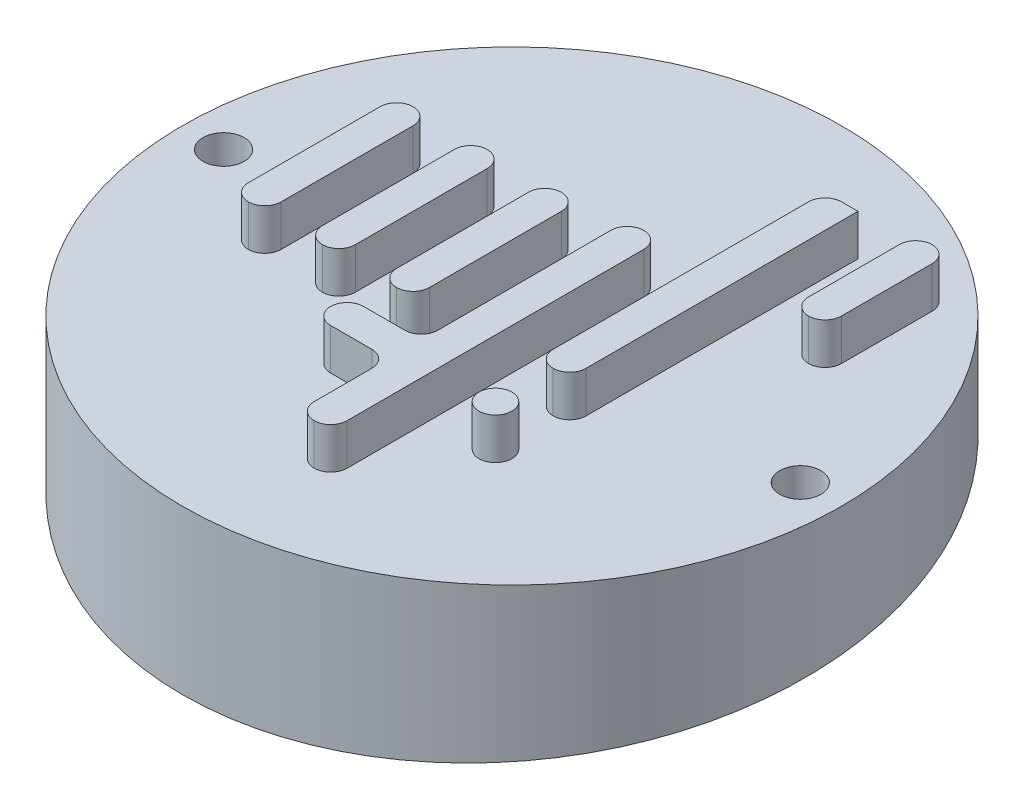
from build123d import *

# Parameters (mm, degrees)
BOSS_EXTRUDE2_DEPTH       = 2.5
SKETCH1_R                 = 1
BOSS_EXTRUDE2_2_DEPTH     = 2.5
SKETCH1_W                 = 2
SKETCH1_H                 = 17.5
BOSS_EXTRUDE2_3_DEPTH     = 2.5
SKETCH1_H_2               = 10
BOSS_EXTRUDE2_4_DEPTH     = 2.5
BOSS_EXTRUDE2_5_DEPTH     = 2.5
BOSS_EXTRUDE2_6_DEPTH     = 2.5
SKETCH1_H_3               = 7.5
BOSS_EXTRUDE2_7_DEPTH     = 2.5
SKETCH1_6_R               = 20
BOSS_EXTRUDE3_DEPTH       = 20
CUT_EXTRUDE1_START        = -27.5000001
CUT_EXTRUDE1_DEPTH        = 40.0000001
FILLET1_R                 = 1
M3X0_5_TAPPED_HOLE1_D     = 2.5
M3X0_5_TAPPED_HOLE1_DEPTH = 2.7
M3X0_5_TAPPED_HOLE1_TIP   = 0.751075774


# Read off the part's stored shape, not the designer's step: Cut-Extrude1
with BuildPart() as part:
    # Sketch1 → Boss-Extrude2 (new body)
    with BuildSketch(Plane(origin=(0, 0, 0), x_dir=(1, 0, 0), z_dir=(0, 1, 0))):
        with BuildLine():
            Line((-2, -20), (0, -20))
            Line((0, -20), (0, 0))
            Line((0, 0), (-2, 0))
            Line((-2, 0), (-2, -12.5))
            Line((-2, -12.5), (-5.5, -12.5))
            ThreePointArc((-5.5, -12.5), (-6.5, -13.5), (-5.5, -14.5))
            Line((-5.5, -14.5), (-2, -14.5))
            Line((-2, -14.5), (-2, -20))
        make_face()
    extrude(amount=BOSS_EXTRUDE2_DEPTH)



with BuildPart() as body_2:
    # Sketch1 → Boss-Extrude2 2 (new body)
    with BuildSketch(Plane(origin=(0, 0, 0), x_dir=(1, 0, 0), z_dir=(0, 1, 0))):
        with Locations(Location((3.5, -13.5, 0), (0, 0, 270))):
            Circle(SKETCH1_R)
    extrude(amount=BOSS_EXTRUDE2_2_DEPTH)


with BuildPart() as body_3:
    # Sketch1 → Boss-Extrude2 3 (new body)
    with BuildSketch(Plane(origin=(0, 0, 0), x_dir=(1, 0, 0), z_dir=(0, 1, 0))):
        with Locations((3.5, -1.25)):
            Rectangle(SKETCH1_W, SKETCH1_H)
    extrude(amount=BOSS_EXTRUDE2_3_DEPTH)


with BuildPart() as body_4:
    # Sketch1 → Boss-Extrude2 4 (new body)
    with BuildSketch(Plane(origin=(0, 0, 0), x_dir=(1, 0, 0), z_dir=(0, 1, 0))):
        with Locations((-5.5, -5.5)):
            Rectangle(SKETCH1_W, SKETCH1_H_2)
    extrude(amount=BOSS_EXTRUDE2_4_DEPTH)


with BuildPart() as body_5:
    # Sketch1 → Boss-Extrude2 5 (new body)
    with BuildSketch(Plane(origin=(0, 0, 0), x_dir=(1, 0, 0), z_dir=(0, 1, 0))):
        with Locations((-10, -5.5)):
            Rectangle(SKETCH1_W, SKETCH1_H_2)
    extrude(amount=BOSS_EXTRUDE2_5_DEPTH)


with BuildPart() as body_6:
    # Sketch1 → Boss-Extrude2 6 (new body)
    with BuildSketch(Plane(origin=(0, 0, 0), x_dir=(1, 0, 0), z_dir=(0, 1, 0))):
        with Locations((-14.5, -5.5)):
            Rectangle(SKETCH1_W, SKETCH1_H_2)
    extrude(amount=BOSS_EXTRUDE2_6_DEPTH)


with BuildPart() as body_7:
    # Sketch1 → Boss-Extrude2 7 (new body)
    with BuildSketch(Plane(origin=(0, 0, 0), x_dir=(1, 0, 0), z_dir=(0, 1, 0))):
        with Locations((8.5, 4.25)):
            Rectangle(SKETCH1_W, SKETCH1_H_3)
    extrude(amount=BOSS_EXTRUDE2_7_DEPTH)


with BuildPart() as part_1:
    add(part.part)

    add(body_2.part)  # Boss-Extrude3 merges body 2

    add(body_3.part)  # Boss-Extrude3 merges body 3

    add(body_4.part)  # Boss-Extrude3 merges body 4

    add(body_5.part)  # Boss-Extrude3 merges body 5

    add(body_6.part)  # Boss-Extrude3 merges body 6

    add(body_7.part)  # Boss-Extrude3 merges body 7
    # Sketch1<6> → Boss-Extrude3 (add)
    with BuildSketch(Plane(origin=(0, 0, 0), x_dir=(1, 0, 0), z_dir=(0, 1, 0))):
        with Locations(Location((-3, -6, 0), (0, 0, 270))):
            Circle(SKETCH1_6_R)
    extrude(amount=-BOSS_EXTRUDE3_DEPTH)

    # Cut-Extrude1 outline → Cut-Extrude1 (cut)
    with BuildSketch(Plane(origin=(4.5, 0, 0), x_dir=(0, 0, -1), z_dir=(1, 0, 0)).offset(CUT_EXTRUDE1_START)):
        Polygon((14, -20), (14, -5.697915295), (-26, -9.902084705), (-26, -20), align=None)
    extrude(amount=CUT_EXTRUDE1_DEPTH, mode=Mode.SUBTRACT)

    # Fillet1
    fillet1_edges = [part_1.edges().sort_by_distance(p)[0] for p in [
        (-13.5, 1.25, 10.5),
        (-13.5, 1.25, 0.5),
        (-9, 1.25, 0.5),
        (-9, 1.25, 10.5),
        (-4.5, 1.25, 0.5),
        (-4.5, 1.25, 10.5),
        (0, 1.25, 20),
        (0, 1.25, 0),
        (9.5, 1.25, -8),
        (9.5, 1.25, -0.5),
        (4.5, 1.25, 10),
        (-15.5, 1.25, 0.5),
        (-15.5, 1.25, 10.5),
        (-11, 1.25, 0.5),
        (-11, 1.25, 10.5),
        (-6.5, 1.25, 0.5),
        (-6.5, 1.25, 10.5),
        (7.5, 1.25, -0.5),
        (7.5, 1.25, -8),
        (2.5, 1.25, -7.5),
        (2.5, 1.25, 10),
        (-2, 1.25, 0),
        (-2, 1.25, 14.5),
        (-2, 1.25, 20),
        (-2, 1.25, 12.5),
    ]]
    fillet(fillet1_edges, radius=FILLET1_R - 0.0001)  # a hair under: the kernel refuses the full size

    # M3x0.5 Tapped Hole1
    with Locations(Plane(origin=(14.5, 0, 6), x_dir=(0, 0, 1), z_dir=(0, 1, 0))):
        with Locations((0, 0), (0, -35)):
            Hole(M3X0_5_TAPPED_HOLE1_D / 2, depth=M3X0_5_TAPPED_HOLE1_DEPTH)
            with Locations((0, 0, -(M3X0_5_TAPPED_HOLE1_DEPTH + M3X0_5_TAPPED_HOLE1_TIP / 2))):  # 118° drill point
                Cone(0, M3X0_5_TAPPED_HOLE1_D / 2, M3X0_5_TAPPED_HOLE1_TIP, mode=Mode.SUBTRACT)


solid = part_1.part
